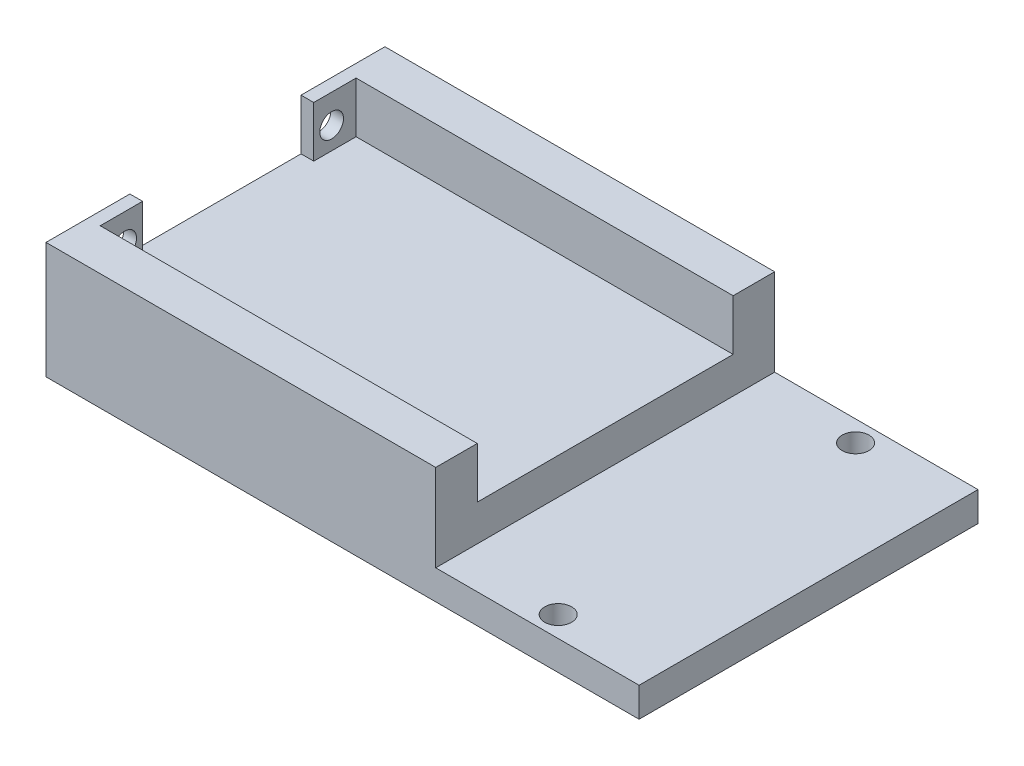
from build123d import *

# Parameters (mm, degrees)
BOSS_EXTRUDE1_DEPTH = 80
BOSS_EXTRUDE2_DEPTH = 12
SKETCH3_R           = 2.795
CUT_EXTRUDE1_DEPTH  = 60
SKETCH4_R           = 3.175
CUT_EXTRUDE2_DEPTH  = 10


with BuildPart() as part:
    # Sketch1 → Boss-Extrude1 (new body)
    with BuildSketch(Plane.XY):
        Polygon((140, 0), (0, 0), (0, 15.49), (92, 15.49), (92, 6.96), (140, 6.96), align=None)
    extrude(amount=BOSS_EXTRUDE1_DEPTH)

    # Sketch2 → Boss-Extrude2 (add)
    with BuildSketch(Plane(origin=(0, 15.49, 0), x_dir=(1, 0, 0), z_dir=(0, 1, 0))):
        Polygon((92, 0), (0, 0), (0, -19.8), (3, -19.8), (3, -9.8), (92, -9.8), align=None)
        Polygon((3, -60.2), (0, -60.2), (0, -80), (92, -80), (92, -70.2), (3, -70.2), align=None)
    extrude(amount=BOSS_EXTRUDE2_DEPTH)

    # Sketch3 → Cut-Extrude1 (cut)
    with BuildSketch(Plane.ZY):
        with Locations((15.57, 20.72)):
            Circle(SKETCH3_R)
        with Locations((64.43, 20.72)):
            Circle(SKETCH3_R)
    extrude(amount=-CUT_EXTRUDE1_DEPTH, mode=Mode.SUBTRACT)

    # Sketch4 → Cut-Extrude2 (cut)
    with BuildSketch(Plane(origin=(0, 6.96, 0), x_dir=(1, 0, 0), z_dir=(0, 1, 0))):
        with Locations((116, -4.9)):
            Circle(SKETCH4_R)
        with Locations((116, -75.1)):
            Circle(SKETCH4_R)
    extrude(amount=-CUT_EXTRUDE2_DEPTH, mode=Mode.SUBTRACT)


solid = part.part
